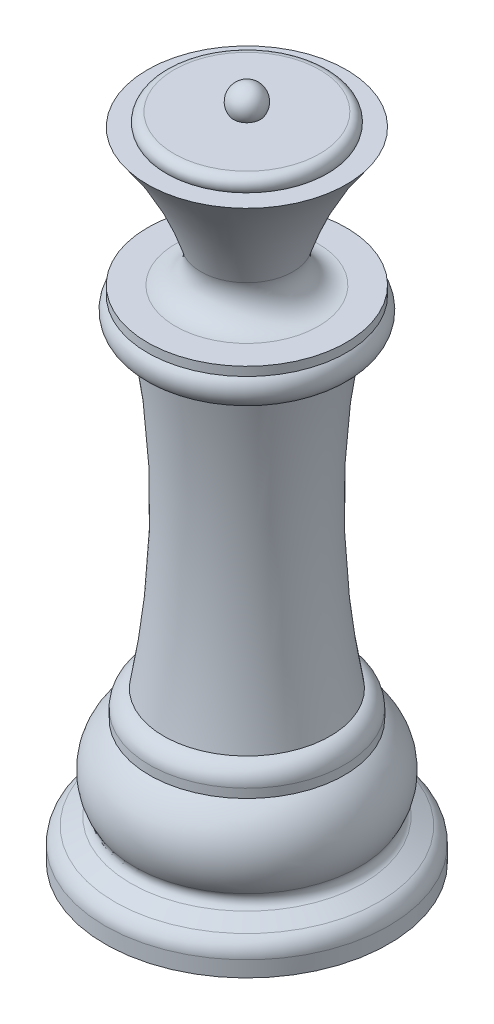
from build123d import *

# Parameters (mm, degrees)
FILLET1_R = 2
FILLET2_R = 1
FILLET3_R = 3


with BuildPart() as part:
    # Sketch1 → Revolve1 (revolve)
    with BuildSketch(Plane.XY):
        with BuildLine():
            Line((-0.021373291, 65.998238541), (-0.021373291, -10))
            Line((-0.021373291, -10), (13.959412098, -10))
            Line((13.959412098, -10), (15.959412098, -10))
            Line((15.959412098, -10), (15.959412098, -7))
            Line((15.959412098, -7), (11.991992379, -5))
            ThreePointArc((11.991992379, -5), (13.510901064, -0.280718375), (10.959412098, 3.97))
            Line((10.959412098, 3.97), (10.959412098, 4.97))
            ThreePointArc((10.959412098, 4.97), (10.516317431, 6.263451807), (9.345787589, 6.97))
            ThreePointArc((9.345787589, 6.97), (7.720871608, 24.46279186), (9.182303149, 41.97))
            ThreePointArc((9.182303149, 41.97), (11.471998628, 42.853075013), (11.182303149, 45.29))
            Line((11.182303149, 45.29), (11.182303149, 46.29))
            Line((11.182303149, 46.29), (4.182303149, 46.29))
            ThreePointArc((4.182303149, 46.29), (6.76997216, 54.409426796), (11.182303149, 61.7))
            Line((11.182303149, 61.7), (9.048328553, 61.7))
            ThreePointArc((9.048328553, 61.7), (9.048328553, 62.7), (8.182303149, 63.2))
            Line((8.182303149, 63.2), (1.5, 63.2))
            ThreePointArc((1.5, 63.2), (1.571165219, 65.051388507), (-0.021373291, 65.998238541))
        make_face()
    revolve(axis=Axis((-0.021373291, 65.998238541, 0), (0, -1, 0)))

    # Fillet1
    fillet1_edges = [part.edges().sort_by_distance(p)[0] for p in [
        (-16.00215868, -7, 0),
    ]]
    fillet(fillet1_edges, radius=FILLET1_R)

    # Fillet2
    fillet2_edges = [part.edges().sort_by_distance(p)[0] for p in [
        (-12.03473896, -5, 0),
    ]]
    fillet(fillet2_edges, radius=FILLET2_R)

    # Fillet3
    fillet3_edges = [part.edges().sort_by_distance(p)[0] for p in [
        (-4.22504973, 46.29, 0),
    ]]
    fillet(fillet3_edges, radius=FILLET3_R)


solid = part.part
